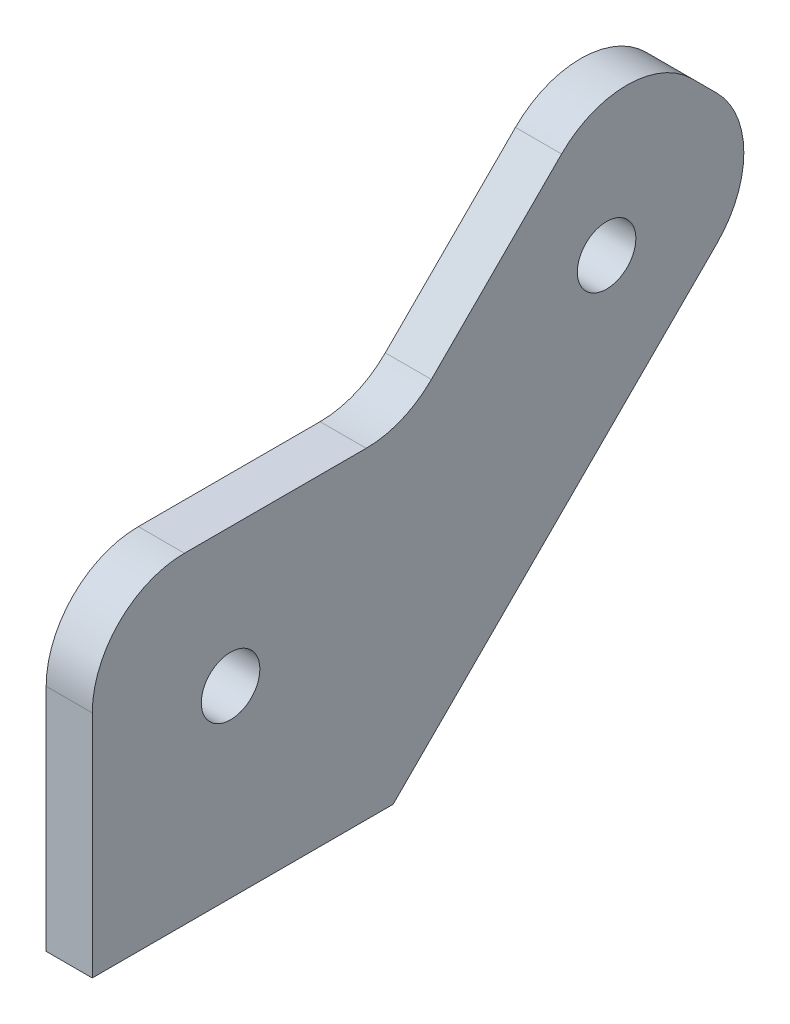
from build123d import *
from build123d.topology import SkipClean

# Parameters (mm, degrees)
SKETCH1_R               = 3.175
EXTRUDE_BODY_DEPTH      = 5
INSET_BODY_DEPTH        = 2
SKETCH3_R               = 6.175
CUT_HOLE_BOSS_DEPTH     = 5
CUT_EXTRUDE2_DEPTH      = 72.874270106
CUT_EXTRUDE2_DEPTH_BACK = 5
REAM_HOLE_R             = 3.175


with BuildPart() as part:
    # Sketch1 → Extrude body (new body)
    with BuildSketch(Plane(origin=(0, 0, 0), x_dir=(0, 0, -1), z_dir=(1, 0, 0))):
        with BuildLine():
            Line((8.114294626, 0), (-24.515196318, 0))
            Line((-24.515196318, 0), (-24.515196318, 24.898772612))
            ThreePointArc((-24.515196318, 24.898772612), (-21.586264129, 31.969840424), (-14.515196318, 34.898772612))
            Line((-14.515196318, 34.898772612), (5.191949728, 34.898772612))
            ThreePointArc((5.191949728, 34.898772612), (9.018784051, 35.659977287), (12.26301754, 37.8277048))
            Line((12.26301754, 37.8277048), (26.380592117, 51.945279378))
            ThreePointArc((26.380592117, 51.945279378), (33.451659929, 54.874211566), (40.52272774, 51.945279378))
            Line((40.52272774, 51.945279378), (43.22008306, 49.247924058))
            ThreePointArc((43.22008306, 49.247924058), (46.149015248, 42.176856246), (43.22008306, 35.105788434))
            Line((43.22008306, 35.105788434), (8.114294626, 0))
        make_face()
        with Locations((31.264803682, 39.99)):
            Circle(SKETCH1_R, mode=Mode.SUBTRACT)
        with Locations((-9.515196318, 19.93)):
            Circle(SKETCH1_R, mode=Mode.SUBTRACT)
    extrude(amount=EXTRUDE_BODY_DEPTH)

    # Sketch2 → Inset body (cut)
    with BuildSketch(Plane(origin=(0, 0, 0), x_dir=(0, 0, -1), z_dir=(1, 0, 0))):
        with BuildLine():
            Line((-21.515196318, 24.898772612), (-21.515196318, 3))
            Line((-21.515196318, 3), (6.871653938, 3))
            Line((6.871653938, 3), (41.098762716, 37.227108778))
            ThreePointArc((41.098762716, 37.227108778), (43.149015248, 42.176856246), (41.098762716, 47.126603714))
            Line((41.098762716, 47.126603714), (38.401407397, 49.823959034))
            ThreePointArc((38.401407397, 49.823959034), (33.451659929, 51.874211566), (28.50191246, 49.823959034))
            Line((28.50191246, 49.823959034), (14.384337883, 35.706384457))
            ThreePointArc((14.384337883, 35.706384457), (10.166834349, 32.88833869), (5.191949728, 31.898772612))
            Line((5.191949728, 31.898772612), (-14.515196318, 31.898772612))
            ThreePointArc((-14.515196318, 31.898772612), (-19.464943786, 29.848520081), (-21.515196318, 24.898772612))
        make_face()
    extrude(amount=INSET_BODY_DEPTH, mode=Mode.SUBTRACT)

    # Sketch3 → Cut hole boss (add)
    with BuildSketch(Plane.ZY.offset(-2)):
        with Locations((9.515196318, 19.93)):
            Circle(SKETCH3_R)
        with Locations((-31.264803682, 39.99)):
            Circle(SKETCH3_R)
    extrude(amount=CUT_HOLE_BOSS_DEPTH)

    # Ream hole → Cut-Extrude2 (cut, two sides: drawn at the far end of the back side and taken through both)
    with SkipClean():  # the faces are left unmerged after this step: merging them gives an invalid solid
        with BuildSketch(Plane.ZY.offset(-CUT_EXTRUDE2_DEPTH_BACK)):
            with Locations((-31.264803682, 39.99)):
                Circle(REAM_HOLE_R)
            with Locations((9.515196318, 19.93)):
                Circle(REAM_HOLE_R)
        extrude(amount=CUT_EXTRUDE2_DEPTH + CUT_EXTRUDE2_DEPTH_BACK, mode=Mode.SUBTRACT)


solid = part.part
